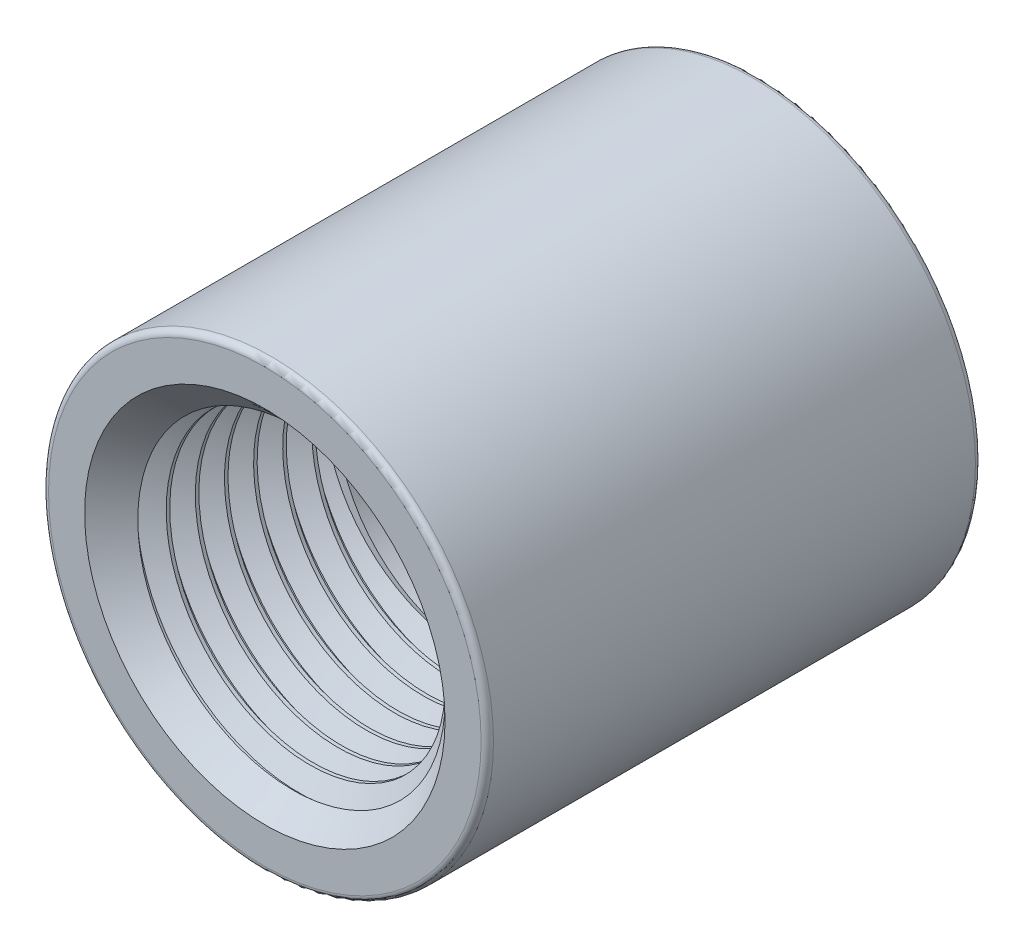
from build123d import *

# Parameters (mm, degrees)
EXTRUDE1_DEPTH           = 15.875
EXTRUDE1_DEPTH_BACK      = 15.875
SKETCH1_R                = 14.2875
SKETCH2_R                = 8.9296875
EXTRUDE2_DEPTH           = 19.8501
SKETCH3_R                = 10.668
EXTRUDE3_DEPTH           = 13.55598
EXTRUDE3_DRAFT           = -1.783333333
SWEEP1_PITCH             = 1.81516488
SWEEP1_HEIGHT            = 15.370265714
SWEEP1_RADIUS            = 10.668
SWEEP1_START_ANGLE       = 90
SKETCH6_R                = 11.575142857
EXTRUDE4_OTHER_WAY_DEPTH = 38.634131028
EXTRUDE4_OTHER_WAY_TAPER = -45
FILLET1_R                = 0.396875


with BuildPart() as part:
    # Sketch1 → Extrude1 (new, two sides: drawn at the far end of the back side and taken through both)
    with BuildSketch(Plane.XY.offset(-EXTRUDE1_DEPTH_BACK)):
        Circle(SKETCH1_R)
    extrude(amount=EXTRUDE1_DEPTH + EXTRUDE1_DEPTH_BACK)

    # Sketch2 → Extrude2 (cut)
    with BuildSketch(Plane.XY.offset(15.875)):
        Circle(SKETCH2_R)
    extrude(amount=-EXTRUDE2_DEPTH, mode=Mode.SUBTRACT)

    # Sketch2.1 → Cut-Revolve1 (revolve, cut)
    with BuildSketch(Plane(origin=(0, 0, 0), x_dir=(0, 0, -1), z_dir=(1, 0, 0)), mode=Mode.PRIVATE) as cut_revolve1_sk:
        Polygon((3.9751, 0), (9.340597559, 0), (23.0251, 0), (23.0251, 8.9296875), (3.9751, 8.9296875), align=None)
    revolve(cut_revolve1_sk.sketch.rotate(Axis((0, 0, 0), (0, 0, -1)), 90), axis=Axis((0, 0, 0), (0, 0, -1)), mode=Mode.SUBTRACT)


with BuildPart() as extrude3_tool:
    # Sketch3 → Extrude3 (with draft: the straight prism first)
    with BuildSketch(Plane.XY.offset(15.875)):
        Circle(SKETCH3_R)
    extrude(amount=-EXTRUDE3_DEPTH)
    # Extrude3: the draft: its side faces are tilted about the plane it starts from
    extrude3_sides = [extrude3_tool.faces().sort_by_distance(p)[0] for p in [
        (-10.668, 0, 9.09701),
    ]]
    draft(extrude3_sides, Plane.XY.offset(15.875), EXTRUDE3_DRAFT)


with BuildPart() as part_1:
    add(part.part)

    # Extrude3: cut by extrude3_tool
    add(extrude3_tool.part, mode=Mode.SUBTRACT)

    # Sweep1: sweep along a helix
    with BuildLine() as sweep1_path:
        # a taper helix: rise per turn along the axis 1.814285714, along the cone's slant (build123d's pitch) 1.81516488
        add(Helix(SWEEP1_PITCH, SWEEP1_HEIGHT, SWEEP1_RADIUS, center=(0, 0, 15.875), direction=(0, 0, -1), cone_angle=-1.783333333, mode=Mode.PRIVATE).rotate(Axis((0, 0, 15.875), (0, 0, -1)), SWEEP1_START_ANGLE))
    # Sketch5 → Sweep1 (sweep)
    with BuildSketch(Plane(origin=(0, 0, 0), x_dir=(0, 0, -1), z_dir=(1, 0, 0))):
        Polygon((-16.782142857, 10.86440219), (-14.967857143, 10.86440219), (-15.761607143, 9.489586861), (-15.988392857, 9.489586861), align=None)
    sweep(path=sweep1_path.line, is_frenet=True)

    # Extrude4 cone 1 section (through the dimple's axis) → Extrude4 (revolve, cut)
    with BuildSketch(Plane(origin=(0, 0, 15.875), x_dir=(0, -1, 0), z_dir=(1, 0, 0))):
        Polygon((0, 0), (11.575142857, 0), (0, 11.575142857), align=None)
    revolve(axis=Axis((0, 0, 15.875), (0, 0, -1)), mode=Mode.SUBTRACT)

    # Sketch6 → Extrude4 other way (cut)
    with BuildSketch(Plane.XY.offset(15.875)):
        Circle(SKETCH6_R)
    extrude(amount=EXTRUDE4_OTHER_WAY_DEPTH, taper=EXTRUDE4_OTHER_WAY_TAPER, mode=Mode.SUBTRACT)

    # Fillet1
    fillet1_edges = [part_1.edges().sort_by_distance(p)[0] for p in [
        (-14.2875, 0, -15.875),
        (-14.2875, 0, 15.875),
    ]]
    fillet(fillet1_edges, radius=FILLET1_R)


solid = part_1.part
